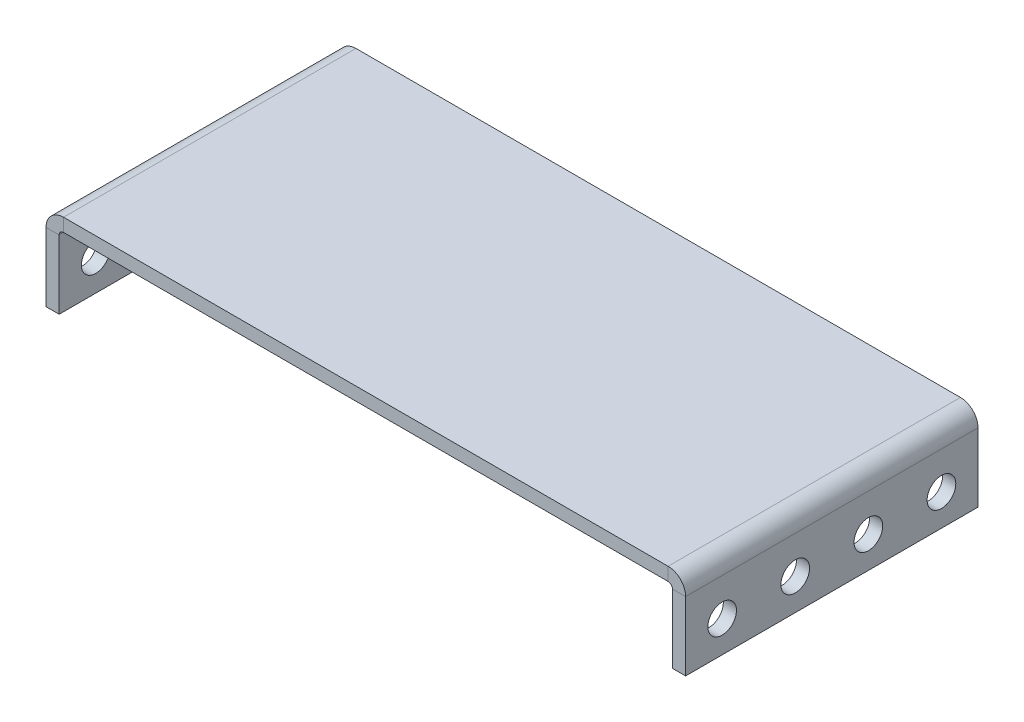
from build123d import *

# Parameters (mm, degrees)
BASE_FLANGE1_DEPTH      = 50.8
CUT_EXTRUDE1_DEPTH      = 76.778703488
CUT_EXTRUDE1_DEPTH_BACK = 76.778703488
SKETCH6_R               = 2.4892


# Sheet-metal steps are written as plain solids
with BuildPart() as part:
    # Sketch1 → Base-Flange1 (new body)
    with BuildSketch(Plane.XY):
        with BuildLine():
            Line((-53.2765, -6.35), (-53.2765, 5.588))
            ThreePointArc((-53.2765, 5.588), (-53.053315367, 6.126815367), (-52.5145, 6.35))
            Line((-52.5145, 6.35), (52.5145, 6.35))
            ThreePointArc((52.5145, 6.35), (53.053315367, 6.126815367), (53.2765, 5.588))
            Line((53.2765, 5.588), (53.2765, -6.35))
            Line((53.2765, -6.35), (55.5625, -6.35))
            Line((55.5625, -6.35), (55.5625, 5.588))
            ThreePointArc((55.5625, 5.588), (54.669761469, 7.743261469), (52.5145, 8.636))
            Line((52.5145, 8.636), (-52.5145, 8.636))
            ThreePointArc((-52.5145, 8.636), (-54.669761469, 7.743261469), (-55.5625, 5.588))
            Line((-55.5625, 5.588), (-55.5625, -6.35))
            Line((-55.5625, -6.35), (-53.2765, -6.35))
        make_face()
    extrude(amount=BASE_FLANGE1_DEPTH)

    # Sketch6 → Cut-Extrude1 (cut, two sides: drawn at the far end of the back side and taken through both)
    with BuildSketch(Plane(origin=(0, 0, 0), x_dir=(0, 0, -1), z_dir=(1, 0, 0)).offset(-CUT_EXTRUDE1_DEPTH_BACK)):
        with Locations((-6.35, -0.888959106)):
            Circle(SKETCH6_R)
        with Locations((-19.05, -0.888959106)):
            Circle(SKETCH6_R)
        with Locations((-31.75, -0.888959106)):
            Circle(SKETCH6_R)
        with Locations((-44.45, -0.888959106)):
            Circle(SKETCH6_R)
    extrude(amount=CUT_EXTRUDE1_DEPTH + CUT_EXTRUDE1_DEPTH_BACK, mode=Mode.SUBTRACT)


solid = part.part
